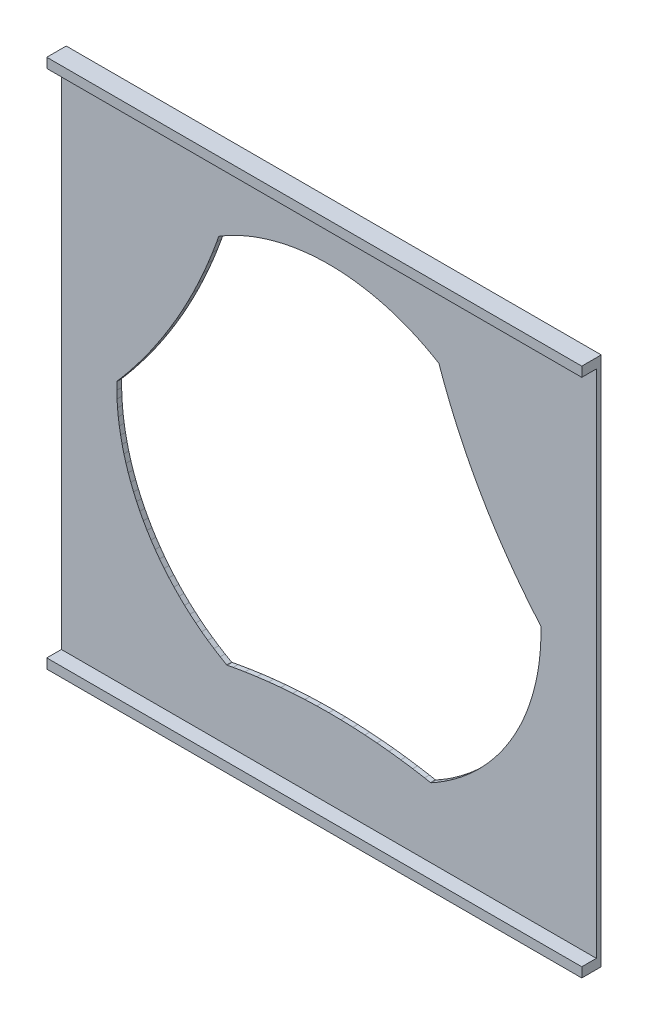
from build123d import *

# Parameters (mm, degrees)
SKETCH2_W           = 115.8494
SKETCH2_H           = 104.9528
BOSS_EXTRUDE1_DEPTH = 1
CUT_EXTRUDE2_DEPTH  = 310.336917135
SKETCH4_W           = 120.264695257
SKETCH4_H           = 108.9528
SKETCH4_W_2         = 115.8494
SKETCH4_H_2         = 104.9528
BOSS_EXTRUDE2_DEPTH = 4
SKETCH5_OUTSIDE_W   = 154.731
SKETCH5_OUTSIDE_H   = 143.419
SKETCH5_OUTSIDE_W_2 = 110
SKETCH5_OUTSIDE_H_2 = 108.9528
CUT_EXTRUDE3_DEPTH  = 313.275917504


with BuildPart() as part:
    # Sketch2 → Boss-Extrude1 (new body)
    with BuildSketch(Plane.XY):
        with Locations((123.380390304, -198.156384233)):
            Rectangle(SKETCH2_W, SKETCH2_H)
    extrude(amount=BOSS_EXTRUDE1_DEPTH)

    # Sketch3 → Cut-Extrude2 (cut, through all)
    with BuildSketch(Plane.XY):
        Polygon((80.636137674, -196.195163546), (82.211155605, -194.289585679), (83.74332748, -192.349388588), (85.23189082, -190.375537884), (86.676109641, -188.369012427), (88.075264151, -186.330808737), (89.428661052, -184.261938059), (90.735629126, -182.163427826), (91.995517764, -180.036320192), (93.207702852, -177.881670557), (94.371582353, -175.700547571), (95.486577785, -173.494036075), (96.552137159, -171.263231213), (97.567730567, -169.009238433), (98.532853124, -166.733179375), (99.447026439, -164.436181567), (100.309795675, -162.119387257), (100.715265554, -160.95166739), (100.727163474, -160.932627479), (100.734928107, -160.911566556), (100.748586502, -160.898349752), (100.758665069, -160.882227282), (100.777644629, -160.870236628), (100.793778875, -160.854629347), (102.117724632, -160.084413066), (103.46790381, -159.361168768), (104.842648668, -158.685786993), (106.240266443, -158.059102348), (107.659029043, -157.481887616), (109.097187771, -156.954855229), (110.552968903, -156.478654326), (112.02457664, -156.053873694), (113.5101931, -155.681037354), (115.007988625, -155.36060456), (116.516111481, -155.092971271), (118.032705515, -154.878467209), (119.555895439, -154.717355855), (121.083804494, -154.609838869), (122.614547088, -154.556047257), (124.146233214, -154.556047257), (125.676975808, -154.609838869), (127.204884862, -154.717355855), (128.728074787, -154.878467209), (130.24466882, -155.092971271), (131.752791676, -155.36060456), (133.250587202, -155.681037354), (134.736203662, -156.053873694), (136.207811398, -156.478654326), (137.663592531, -156.954855229), (139.101751259, -157.481887616), (140.520513859, -158.059102348), (141.918131633, -158.685786993), (143.292876492, -159.361168768), (144.64305567, -160.084413066), (145.967001427, -160.854629347), (145.983134201, -160.870236628), (146.002115233, -160.882227282), (146.012192328, -160.898349752), (146.025852193, -160.911566557), (146.033615353, -160.932627481), (146.045502968, -160.951670337), (146.450972747, -162.11939171), (147.313743256, -164.436186094), (148.227916375, -166.733183981), (149.193040208, -169.009243121), (150.208633423, -171.263234516), (151.274192606, -173.494040942), (152.389189321, -175.700552533), (153.553068635, -177.881674147), (154.76525501, -180.036323886), (156.025143466, -182.163431628), (157.332112833, -184.261941973), (158.685509556, -186.330812767), (160.084665363, -188.369016576), (161.528884013, -190.375540686), (163.017448656, -192.349391517), (164.549620365, -194.289587267), (166.124638132, -196.195165269), (166.933179973, -197.130172894), (166.943714849, -197.149992949), (166.958076843, -197.167250308), (166.962682411, -197.185689333), (166.971606955, -197.20247566), (166.972498968, -197.224905514), (166.977949667, -197.246683286), (166.983002935, -198.778362052), (166.93427476, -200.309274221), (166.831799266, -201.837529188), (166.675714684, -203.361243133), (166.466216786, -204.87853488), (166.203560223, -206.387533557), (165.88807177, -207.886377125), (165.520138557, -209.37321679), (165.10021542, -210.846217009), (164.628821966, -212.303561372), (164.106536677, -213.743452606), (163.534007221, -215.164111101), (162.911937196, -216.56378816), (162.241094972, -217.940754218), (161.522309266, -219.293312097), (160.756464731, -220.619792584), (159.944509315, -221.918557379), (159.087442485, -223.188006452), (158.186321113, -224.426573628), (157.24225948, -225.632729533), (156.256418969, -226.804986007), (155.230019841, -227.941897576), (154.164325046, -229.042061454), (153.060650522, -230.104120488), (151.920357842, -231.126763152), (150.744855679, -232.108729442), (149.535590976, -233.048806457), (148.294057784, -233.945835757), (147.02178842, -234.79870895), (145.72035053, -235.606376522), (144.391351505, -236.367840478), (144.369768033, -236.374006554), (144.349893516, -236.384451641), (144.330891876, -236.385116971), (144.312617906, -236.390339216), (144.290495694, -236.386531234), (144.26805848, -236.387318737), (143.054048152, -236.154604954), (140.616259513, -235.743388511), (138.169915795, -235.386587794), (135.716228426, -235.084377968), (133.256417669, -234.836912118), (130.791703785, -234.644309473), (128.323311453, -234.506668654), (125.852463877, -234.424057374), (123.380383335, -234.396515449), (120.908316425, -234.424057374), (118.437468849, -234.506668654), (115.969076517, -234.644309473), (113.504362633, -234.836912118), (111.044551876, -235.084377968), (108.590864507, -235.386587794), (106.144520789, -235.743388511), (103.70673215, -236.154604954), (102.492721822, -236.387317265), (102.470283136, -236.386531234), (102.448162396, -236.390339216), (102.429886436, -236.385116672), (102.410886269, -236.384451343), (102.39101028, -236.374006255), (102.369428279, -236.36784018), (101.040429254, -235.606377695), (99.738991365, -234.798710123), (98.466720529, -233.94583693), (97.225187336, -233.04880763), (96.015924106, -232.108730616), (94.84042047, -231.126764325), (93.70012779, -230.104121661), (92.596453267, -229.042062627), (91.530758472, -227.941898749), (90.504357872, -226.80498718), (89.518518833, -225.632730707), (88.5744572, -224.426574802), (87.673335828, -223.188007625), (86.816268997, -221.918558552), (86.004312109, -220.619792286), (85.238469047, -219.29331327), (84.519681869, -217.940755391), (83.848841116, -216.563789333), (83.226771092, -215.164112275), (82.654240163, -213.743452307), (82.131956346, -212.303562545), (81.66056142, -210.846218182), (81.240638284, -209.373216491), (80.872705071, -207.886378298), (80.557216618, -206.38753473), (80.294560054, -204.878536053), (80.085062156, -203.361242834), (79.928977574, -201.83752889), (79.82650208, -200.309273922), (79.777762264, -198.778362052), (79.782817003, -197.246683286), (79.788267702, -197.224905514), (79.789161187, -197.20247566), (79.798084259, -197.185689333), (79.802700352, -197.167248513), (79.817060875, -197.149991156), (79.827597225, -197.130171102), align=None)
    extrude(amount=CUT_EXTRUDE2_DEPTH, mode=Mode.SUBTRACT)

    # Sketch4 → Boss-Extrude2 (add)
    with BuildSketch(Plane.XY):
        with Locations((123.380390305, -198.156384233)):
            Rectangle(SKETCH4_W, SKETCH4_H)
        with Locations((123.380390304, -198.156384233)):
            Rectangle(SKETCH4_W_2, SKETCH4_H_2, mode=Mode.SUBTRACT)
    extrude(amount=BOSS_EXTRUDE2_DEPTH)

    # Sketch5 outside → Cut-Extrude3 (cut, through all)
    with BuildSketch(Plane.XY):
        with Locations((123.3805, -198.1565)):
            Rectangle(SKETCH5_OUTSIDE_W, SKETCH5_OUTSIDE_H)
        with Locations((123.380390304, -198.156384233)):
            Rectangle(SKETCH5_OUTSIDE_W_2, SKETCH5_OUTSIDE_H_2, mode=Mode.SUBTRACT)
    extrude(amount=CUT_EXTRUDE3_DEPTH, mode=Mode.SUBTRACT)


solid = part.part
